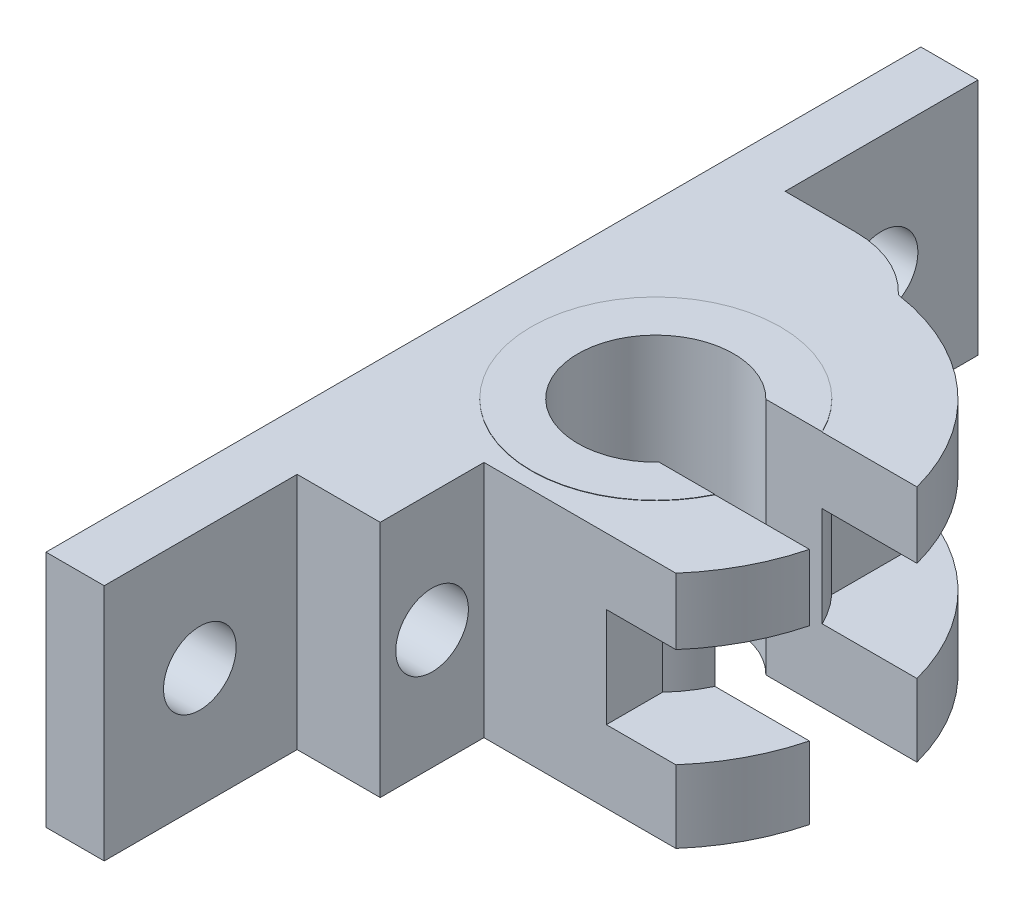
from build123d import *

# Parameters (mm, degrees)
SKETCH_1_R           = 20.68
SKETCH_1_R_2         = 9.68
EXTRUDE_1_DEPTH      = 116.68
SKETCH_11_W          = 27
SKETCH_11_H          = 150
CUT_EXTRUDE_3_DEPTH  = 40
SKETCH_13_W          = 10
SKETCH_13_H          = 128.345013401
CUT_EXTRUDE_7_DEPTH  = 126.614916312
SKETCH_15_W          = 8
SKETCH_15_H          = 68.68
CUT_EXTRUDE_9_DEPTH  = 48
SKETCH_16_W          = 15.549431524
SKETCH_16_H          = 20
SKETCH_16_W_2        = 15.459431524
EXTRUDE_4_DEPTH      = 19.2
SKETCH_17_W          = 19.20851187
SKETCH_17_H          = 14.03
CUT_EXTRUDE_10_DEPTH = 20.2
SKETCH_18_R          = 9.59
CUT_EXTRUDE_11_DEPTH = 121.289430957
SKETCH_21_R          = 2.985
CUT_EXTRUDE_12_DEPTH = 55.2
EXTRUDE_START        = 55.2
SKETCH_24_R          = 20.59
SKETCH_24_R_2        = 9.59
EXTRUDE_2_DEPTH      = 55.2
CUT_EXTRUDE_13_DEPTH = 55.2
SKETCH_26_W          = 10.00851187
SKETCH_26_H          = 41.68
CUT_EXTRUDE_15_DEPTH = 55.2
SKETCH_27_W          = 10
SKETCH_27_H          = 40
CUT_EXTRUDE_16_DEPTH = 55.2
SKETCH_28_W          = 44.880694938
SKETCH_28_H          = 9.608044066
CUT_EXTRUDE_17_DEPTH = 12.2
SKETCH_35_W          = 13.53
SKETCH_35_H          = 20
EXTRUDE_10_DEPTH     = 15
EXTRUDE_11_DEPTH     = 15
SKETCH_37_W          = 9
SKETCH_37_H          = 20
EXTRUDE_12_DEPTH     = 20
SKETCH_38_W          = 9
SKETCH_38_H          = 20
EXTRUDE_13_DEPTH     = 20
SKETCH_42_R          = 2.985
CUT_EXTRUDE_21_DEPTH = 20
CUT_EXTRUDE_23_DEPTH = 138.235841092
SKETCH_45_W          = 3
SKETCH_45_H          = 20
EXTRUDE_14_DEPTH     = 30
SKETCH_46_W          = 3
SKETCH_46_H          = 20
EXTRUDE_15_DEPTH     = 30
SKETCH_47_W          = 33.078221107
SKETCH_47_H          = 20
EXTRUDE_16_DEPTH     = 50
SKETCH_48_W          = 30
SKETCH_48_H          = 20
EXTRUDE_17_DEPTH     = 50
SKETCH_50_W          = 50
SKETCH_50_H          = 20
EXTRUDE_18_DEPTH     = 1
SKETCH_51_W          = 50
SKETCH_51_H          = 20
EXTRUDE_19_DEPTH     = 1
SKETCH_52_W          = 53
SKETCH_52_H          = 14
CUT_EXTRUDE_24_DEPTH = 151.972575738
SKETCH_53_W          = 53
SKETCH_53_H          = 14
CUT_EXTRUDE_25_DEPTH = 151.942387436
SKETCH_54_W          = 40
SKETCH_54_H          = 73.27
CUT_EXTRUDE_26_DEPTH = 147.866192927
SKETCH_56_W          = 13.00851187
SKETCH_56_H          = 20
EXTRUDE_21_DEPTH     = 3.08
SKETCH_60_W          = 6.504255935
SKETCH_60_H          = 76.35
CUT_EXTRUDE_30_DEPTH = 137.106994034
CUT_EXTRUDE_32_DEPTH = 20
SKETCH_64_W          = 16.20851187
SKETCH_64_H          = 0.09
EXTRUDE_22_DEPTH     = 20
SKETCH_65_W          = 3.495744065
SKETCH_65_H          = 3.26
CUT_EXTRUDE_33_DEPTH = 137.057988464
SKETCH_66_W          = 3.495744065
SKETCH_66_H          = 1.776778893
SKETCH_66_W_2        = 3.503635083
SKETCH_66_H_2        = 1.775
EXTRUDE_23_DEPTH     = 20.2
SKETCH_68_W          = 6.504255935
SKETCH_68_H          = 3.66
CUT_EXTRUDE_34_DEPTH = 20
SKETCH_69_R          = 2.985
CUT_EXTRUDE_35_DEPTH = 126.598983893
SKETCH_70_R          = 2.985
CUT_EXTRUDE_36_DEPTH = 132.360728238
SKETCH_71_W          = 38.005321573
SKETCH_71_H          = 111.965885132
CUT_EXTRUDE_37_DEPTH = 147.475577566
SKETCH_72_R          = 9.7
CUT_EXTRUDE_38_DEPTH = 38.185254838
CUT_EXTRUDE_START    = -22
SKETCH_77_R          = 30.59
SKETCH_77_R_2        = 20.59
CUT_EXTRUDE_2_DEPTH  = 22
SKETCH_78_W          = 34.816185151
SKETCH_78_H          = 22.96559116
EXTRUDE_26_DEPTH     = 0.1
SKETCH_80_W          = 2.900031179
SKETCH_80_H          = 6.148706656
EXTRUDE_28_DEPTH     = 23.1
SKETCH_81_W          = 6.148706656
SKETCH_81_H          = 23.1
EXTRUDE_29_DEPTH     = 14.1
SKETCH_82_W          = 6.148706656
SKETCH_82_H          = 0.13440884
CUT_EXTRUDE_39_DEPTH = 19.1
SKETCH_83_W          = 2.900031179
SKETCH_83_H          = 22.96559116
EXTRUDE_30_DEPTH     = 19.1
FILLET_1_R           = 10
SKETCH_84_W          = 3.5
SKETCH_84_H          = 19.1
EXTRUDE_31_DEPTH     = 23.1
SKETCH_85_W          = 3.5
SKETCH_85_H          = 0.52
CUT_EXTRUDE_40_DEPTH = 48.860163141
SKETCH_86_W          = 3.5
SKETCH_86_H          = 22.96559116
EXTRUDE_32_DEPTH     = 62.1
SKETCH_87_W          = 3.60851187
SKETCH_87_H          = 34.816185151
CUT_EXTRUDE_41_DEPTH = 62.1
SKETCH_89_W          = 0.10851187
SKETCH_89_H          = 6.15
EXTRUDE_33_DEPTH     = 23.1
EXTRUDE_34_DEPTH     = 22.1
SKETCH_91_W          = 0.971561636
SKETCH_91_H          = 22.96559116
CUT_EXTRUDE_42_DEPTH = 22.1
SKETCH_95_W          = 6.15
SKETCH_95_H          = 22.96559116
EXTRUDE_35_DEPTH     = 14.1
FILLET_2_R           = 10
SKETCH_96_W          = 3.60851187
SKETCH_96_H          = 2.548438364
CUT_EXTRUDE_43_DEPTH = 55.35700885
SKETCH_97_W          = 3.5
SKETCH_97_H          = 6.148706656
EXTRUDE_36_DEPTH     = 23.1
CUT_EXTRUDE_44_DEPTH = 23.1
SKETCH_99_W          = 6.15
SKETCH_99_H          = 0.13440884
CUT_EXTRUDE_45_DEPTH = 23.1
SKETCH_101_R         = 2.985
CUT_EXTRUDE_46_DEPTH = 23.1
SKETCH_103_W         = 3.60851187
SKETCH_103_H         = 0.54
CUT_EXTRUDE_49_DEPTH = 53.222714265
SKETCH_104_W         = 3.60851187
SKETCH_104_H         = 0.54
CUT_EXTRUDE_50_DEPTH = 53.222714265
SKETCH_123_W         = 24.188706656
SKETCH_123_H         = 22.96559116
SKETCH_123_W_2       = 24.195376485
EXTRUDE_37_DEPTH     = 2
SKETCH_124_R         = 3.05
CUT_EXTRUDE_60_DEPTH = 57.152183688
SKETCH_126_W         = 29.889481087
SKETCH_126_H         = 8.39
CUT_EXTRUDE_61_DEPTH = 53.222714265
SKETCH_127_W         = 18.58
SKETCH_127_H         = 22.96559116
EXTRUDE_38_DEPTH     = 10
SKETCH_128_R         = 3.25
CUT_EXTRUDE_62_DEPTH = 58.155273368
SKETCH_129_R         = 3.25
CUT_EXTRUDE_63_DEPTH = 58.155273368
SKETCH_130_W         = 24.958479246
SKETCH_130_H         = 10
CUT_EXTRUDE_64_DEPTH = 53.058343712
SKETCH_136_W         = 10
SKETCH_136_H         = 18.585376485
CUT_EXTRUDE_68_DEPTH = 24
SKETCH_138_W         = 5.60851187
SKETCH_138_H         = 22.96559116
EXTRUDE_40_DEPTH     = 38
SKETCH_141_W         = 9.994623515
SKETCH_141_H         = 22.96559116
EXTRUDE_41_DEPTH     = 3.24
SKETCH_144_W         = 2
SKETCH_144_H         = 9.994623515
CUT_EXTRUDE_70_DEPTH = 32.24
SKETCH_146_R         = 3.5
CUT_EXTRUDE_72_DEPTH = 54.719053459
SKETCH_150_R         = 3.5
CUT_EXTRUDE_74_DEPTH = 50.508459618
SKETCH_152_W         = 22.731002657
SKETCH_152_H         = 10.39
CUT_EXTRUDE_75_DEPTH = 40.05
SKETCH_153_R         = 11.995
SKETCH_153_R_2       = 6.995
EXTRUDE_3_DEPTH      = 23
CUT_EXTRUDE_76_DEPTH = 27
SKETCH_156_R         = 7.5
CUT_EXTRUDE_77_DEPTH = 40


with BuildPart() as part:
    # 草圖1 → 伸長-薄件1 (new body)
    with BuildSketch(Plane(origin=(0, 0, 0), x_dir=(1, 0, 0), z_dir=(0, 1, 0))):
        Circle(SKETCH_1_R)
        Circle(SKETCH_1_R_2, mode=Mode.SUBTRACT)
    extrude(amount=EXTRUDE_1_DEPTH)

    # 草圖11 → 除料-伸長3 (cut)
    with BuildSketch(Plane(origin=(0, 116.68, 0), x_dir=(1, 0, 0), z_dir=(0, 1, 0))):
        with Locations((21.70851187, -44.235815192)):
            Rectangle(SKETCH_11_W, SKETCH_11_H)
    extrude(amount=-CUT_EXTRUDE_3_DEPTH, mode=Mode.SUBTRACT)

    # 草圖13 → 除料-伸長7 (cut, through all)
    with BuildSketch(Plane.XY.offset(21)):
        with Locations((-16, 58.612182466)):
            Rectangle(SKETCH_13_W, SKETCH_13_H)
    extrude(amount=-CUT_EXTRUDE_7_DEPTH, mode=Mode.SUBTRACT)

    # 草圖15 → 除料-伸長9 (cut)
    with BuildSketch(Plane.XY.offset(21)):
        with Locations((-1.395744065, 52.34)):
            Rectangle(SKETCH_15_W, SKETCH_15_H)
    extrude(amount=-CUT_EXTRUDE_9_DEPTH, mode=Mode.SUBTRACT)

    # 草圖16 → 填料-伸長4 (add)
    with BuildSketch(Plane(origin=(8.20851187, 0, 0), x_dir=(0, 0, -1), z_dir=(1, 0, 0))):
        with Locations((12.905284238, 106.68)):
            Rectangle(SKETCH_16_W, SKETCH_16_H)
        with Locations((-12.860284238, 106.68)):
            Rectangle(SKETCH_16_W_2, SKETCH_16_H)
    extrude(amount=-EXTRUDE_4_DEPTH)

    # 草圖17 → 除料-伸長10 (cut)
    with BuildSketch(Plane(origin=(0, 116.68, 0), x_dir=(1, 0, 0), z_dir=(0, 1, 0))):
        with Locations((-1.395744065, -0.045)):
            Rectangle(SKETCH_17_W, SKETCH_17_H)
    extrude(amount=-CUT_EXTRUDE_10_DEPTH, mode=Mode.SUBTRACT)

    # 草圖18 → 除料-伸長11 (cut, through all)
    with BuildSketch(Plane.XZ):
        with Locations(Location((0, 0, 0), (0, 0, 90))):
            Circle(SKETCH_18_R)
    extrude(amount=-CUT_EXTRUDE_11_DEPTH, mode=Mode.SUBTRACT)

    # 草圖21 → 除料-伸長12 (cut)
    with BuildSketch(Plane(origin=(0, 0, -20.68), x_dir=(-1, 0, 0), z_dir=(0, 0, -1))):
        with Locations((1.39148813, 108.73)):
            Circle(SKETCH_21_R)
    extrude(amount=-CUT_EXTRUDE_12_DEPTH, mode=Mode.SUBTRACT)

    # 草圖24 → 伸長-薄件2 (add)
    with BuildSketch(Plane.XZ.offset(EXTRUDE_START)):
        Circle(SKETCH_24_R)
        Circle(SKETCH_24_R_2, mode=Mode.SUBTRACT)
    extrude(amount=-EXTRUDE_2_DEPTH)

    # 草圖25 → 除料-伸長13 (cut)
    with BuildSketch(Plane.XY.offset(21)):
        Polygon((-1.39148813, -11.785), (22.612379708, -11.785), (22.612379708, -63.873337429), (-22.749525245, -63.873337429), (-22.749525245, -11.785), align=None)
    extrude(amount=-CUT_EXTRUDE_13_DEPTH, mode=Mode.SUBTRACT)

    # 草圖26 → 除料-伸長15 (cut)
    with BuildSketch(Plane(origin=(0, 0, 0), x_dir=(1, 0, 0), z_dir=(0, 1, 0))):
        with Locations((-15.995744065, -0.16)):
            Rectangle(SKETCH_26_W, SKETCH_26_H)
    extrude(amount=-CUT_EXTRUDE_15_DEPTH, mode=Mode.SUBTRACT)

    # 草圖27 → 除料-伸長16 (cut)
    with BuildSketch(Plane(origin=(21, 0, 0), x_dir=(0, 0, -1), z_dir=(1, 0, 0))):
        with Locations((0, 41.68)):
            Rectangle(SKETCH_27_W, SKETCH_27_H)
    extrude(amount=-CUT_EXTRUDE_16_DEPTH, mode=Mode.SUBTRACT)

    # 草圖28 → 除料-伸長17 (cut)
    with BuildSketch(Plane(origin=(21, 0, 0), x_dir=(0, 0, -1), z_dir=(1, 0, 0))):
        Rectangle(SKETCH_28_W, SKETCH_28_H)
    extrude(amount=-CUT_EXTRUDE_17_DEPTH, mode=Mode.SUBTRACT)

    # 草圖35 → 填料-伸長10 (add)
    with BuildSketch(Plane.ZY.offset(10.99148813)):
        with Locations((13.825, 106.68)):
            Rectangle(SKETCH_35_W, SKETCH_35_H)
    extrude(amount=EXTRUDE_10_DEPTH)

    # 草圖36 → 填料-伸長11 (add)
    with BuildSketch(Plane.ZY.offset(10.99148813)):
        Polygon((-20.68, 116.68), (-6.97, 116.68), (-6.97, 96.48), (-20.68, 96.68), align=None)
    extrude(amount=EXTRUDE_11_DEPTH)

    # 草圖37 → 填料-伸長12 (add)
    with BuildSketch(Plane.XY.offset(20.59)):
        with Locations((-21.49148813, 106.68)):
            Rectangle(SKETCH_37_W, SKETCH_37_H)
    extrude(amount=EXTRUDE_12_DEPTH)

    # 草圖38 → 填料-伸長13 (add)
    with BuildSketch(Plane(origin=(0, 0, -20.68), x_dir=(-1, 0, 0), z_dir=(0, 0, -1))):
        with Locations((21.49148813, 106.68)):
            Rectangle(SKETCH_38_W, SKETCH_38_H)
    extrude(amount=EXTRUDE_13_DEPTH)

    # 草圖42 → 除料-伸長21 (cut)
    with BuildSketch(Plane(origin=(-16.99148813, 0, 0), x_dir=(0, 0, -1), z_dir=(1, 0, 0))):
        with Locations((30.68, 106.554418142)):
            Circle(SKETCH_42_R)
        with Locations((-30.395640125, 106.68)):
            Circle(SKETCH_42_R)
    extrude(amount=-CUT_EXTRUDE_21_DEPTH, mode=Mode.SUBTRACT)

    # 草圖43 → 除料-伸長23 (cut, through all)
    with BuildSketch(Plane(origin=(0, 116.68, 0), x_dir=(1, 0, 0), z_dir=(0, 1, 0))):
        Polygon((-11, 6.97), (-10.99148813, 20.68), (-10.99148813, 48.096794253), (-28.274756234, 48.096794253), (-28.274756234, -43.270506289), (-11, -43.270506289), align=None)
    extrude(amount=-CUT_EXTRUDE_23_DEPTH, mode=Mode.SUBTRACT)

    # 草圖45 → 填料-伸長14 (add)
    with BuildSketch(Plane.XY.offset(20.59)):
        with Locations((-9.5, 106.68)):
            Rectangle(SKETCH_45_W, SKETCH_45_H)
    extrude(amount=EXTRUDE_14_DEPTH)

    # 草圖46 → 填料-伸長15 (add)
    with BuildSketch(Plane(origin=(0, 0, -20.68), x_dir=(-1, 0, 0), z_dir=(0, 0, -1))):
        with Locations((9.49148813, 106.68)):
            Rectangle(SKETCH_46_W, SKETCH_46_H)
    extrude(amount=EXTRUDE_15_DEPTH)

    # 草圖47 → 填料-伸長16 (add)
    with BuildSketch(Plane.ZY.offset(11)):
        with Locations((34.050889447, 106.68)):
            Rectangle(SKETCH_47_W, SKETCH_47_H)
    extrude(amount=EXTRUDE_16_DEPTH)

    # 草圖48 → 填料-伸長17 (add)
    with BuildSketch(Plane.ZY.offset(10.99148813)):
        with Locations((-35.68, 106.68)):
            Rectangle(SKETCH_48_W, SKETCH_48_H)
    extrude(amount=EXTRUDE_17_DEPTH)

    # 草圖50 → 填料-伸長18 (add)
    with BuildSketch(Plane(origin=(0, 0, 17.511778893), x_dir=(-1, 0, 0), z_dir=(0, 0, -1))):
        with Locations((36, 106.68)):
            Rectangle(SKETCH_50_W, SKETCH_50_H)
    extrude(amount=EXTRUDE_18_DEPTH)

    # 草圖51 → 填料-伸長19 (add)
    with BuildSketch(Plane.XY.offset(-20.68)):
        with Locations((-35.99148813, 106.68)):
            Rectangle(SKETCH_51_W, SKETCH_51_H)
    extrude(amount=EXTRUDE_19_DEPTH)

    # 草圖52 → 除料-伸長24 (cut, through all)
    with BuildSketch(Plane(origin=(0, 116.68, 0), x_dir=(1, 0, 0), z_dir=(0, 1, 0))):
        with Locations((-34.49148813, 43.68)):
            Rectangle(SKETCH_52_W, SKETCH_52_H)
    extrude(amount=-CUT_EXTRUDE_24_DEPTH, mode=Mode.SUBTRACT)

    # 草圖53 → 除料-伸長25 (cut, through all)
    with BuildSketch(Plane(origin=(0, 116.68, 0), x_dir=(1, 0, 0), z_dir=(0, 1, 0))):
        with Locations((-34.5, -43.59)):
            Rectangle(SKETCH_53_W, SKETCH_53_H)
    extrude(amount=-CUT_EXTRUDE_25_DEPTH, mode=Mode.SUBTRACT)

    # 草圖54 → 除料-伸長26 (cut, through all)
    with BuildSketch(Plane(origin=(0, 116.68, 0), x_dir=(1, 0, 0), z_dir=(0, 1, 0))):
        with Locations((-41, 0.045)):
            Rectangle(SKETCH_54_W, SKETCH_54_H)
    extrude(amount=-CUT_EXTRUDE_26_DEPTH, mode=Mode.SUBTRACT)

    # 草圖56 → 填料-伸長21 (add)
    with BuildSketch(Plane(origin=(0, 0, -36.68), x_dir=(-1, 0, 0), z_dir=(0, 0, -1))):
        with Locations((14.495744065, 106.68)):
            Rectangle(SKETCH_56_W, SKETCH_56_H)
    extrude(amount=EXTRUDE_21_DEPTH)

    # 草圖60 → 除料-伸長30 (cut, through all)
    with BuildSketch(Plane(origin=(0, 116.68, 0), x_dir=(1, 0, 0), z_dir=(0, 1, 0))):
        with Locations((-17.747872032, 1.585)):
            Rectangle(SKETCH_60_W, SKETCH_60_H)
    extrude(amount=-CUT_EXTRUDE_30_DEPTH, mode=Mode.SUBTRACT)

    # 草圖61 → 除料-伸長32 (cut)
    with BuildSketch(Plane(origin=(0, 116.68, 0), x_dir=(1, 0, 0), z_dir=(0, 1, 0))):
        Polygon((1.92725193, -20.59), (1.92725193, -22.399121663), (-2.174190472, -21.421542421), (-2.174190472, -20.59), align=None)
    extrude(amount=-CUT_EXTRUDE_32_DEPTH, mode=Mode.SUBTRACT)

    # 草圖64 → 填料-伸長22 (add)
    with BuildSketch(Plane(origin=(0, 116.68, 0), x_dir=(1, 0, 0), z_dir=(0, 1, 0))):
        with Locations((0.104255935, -20.635)):
            Rectangle(SKETCH_64_W, SKETCH_64_H)
    extrude(amount=-EXTRUDE_22_DEPTH)

    # 草圖65 → 除料-伸長33 (cut, through all)
    with BuildSketch(Plane(origin=(0, 116.68, 0), x_dir=(1, 0, 0), z_dir=(0, 1, 0))):
        with Locations((-12.747872033, -18.141778893)):
            Rectangle(SKETCH_65_W, SKETCH_65_H)
    extrude(amount=-CUT_EXTRUDE_33_DEPTH, mode=Mode.SUBTRACT)

    # 草圖66 → 填料-伸長23 (add)
    with BuildSketch(Plane(origin=(0, 96.48, 0), x_dir=(1, 0, 0), z_dir=(0, 1, 0))):
        with Locations((-12.747872033, -18.883389447)):
            Rectangle(SKETCH_66_W, SKETCH_66_H)
        with Locations((-12.743926524, 18.7925)):
            Rectangle(SKETCH_66_W_2, SKETCH_66_H_2)
    extrude(amount=EXTRUDE_23_DEPTH)

    # 草圖68 → 除料-伸長34 (cut)
    with BuildSketch(Plane(origin=(0, 116.68, 0), x_dir=(1, 0, 0), z_dir=(0, 1, 0))):
        with Locations((-11.243616098, 37.93)):
            Rectangle(SKETCH_68_W, SKETCH_68_H)
    extrude(amount=-CUT_EXTRUDE_34_DEPTH, mode=Mode.SUBTRACT)

    # 草圖69 → 除料-伸長35 (cut, through all)
    with BuildSketch(Plane(origin=(-7.99148813, 0, 0), x_dir=(0, 0, -1), z_dir=(1, 0, 0))):
        with Locations((28.39, 106.68)):
            Circle(SKETCH_69_R)
        with Locations((-28.635, 106.68)):
            Circle(SKETCH_69_R)
    extrude(amount=-CUT_EXTRUDE_35_DEPTH, mode=Mode.SUBTRACT)

    # 草圖70 → 除料-伸長36 (cut, through all)
    with BuildSketch(Plane(origin=(0, 0, 20.59), x_dir=(-1, 0, 0), z_dir=(0, 0, -1))):
        with Locations((1.39148813, 108.73)):
            Circle(SKETCH_70_R)
    extrude(amount=-CUT_EXTRUDE_36_DEPTH, mode=Mode.SUBTRACT)

    # 草圖71 → 除料-伸長37 (cut, through all)
    with BuildSketch(Plane.XY.offset(50)):
        with Locations((2.76131712, 67.163533726)):
            Rectangle(SKETCH_71_W, SKETCH_71_H)
    extrude(amount=-CUT_EXTRUDE_37_DEPTH, mode=Mode.SUBTRACT)

    # 草圖72 → 除料-伸長38 (cut, through all)
    with BuildSketch(Plane.XZ.offset(11.785)):
        with Locations(Location((0, 0, 0), (0, 0, 270))):
            Circle(SKETCH_72_R)
    extrude(amount=-CUT_EXTRUDE_38_DEPTH, mode=Mode.SUBTRACT)

    # 草圖77 → 除料-伸長-薄件2 (cut)
    with BuildSketch(Plane(origin=(0, 11.18059116, 0), x_dir=(1, 0, 0), z_dir=(0, 1, 0)).offset(CUT_EXTRUDE_START)):
        Circle(SKETCH_77_R)
        Circle(SKETCH_77_R_2, mode=Mode.SUBTRACT)
    extrude(amount=CUT_EXTRUDE_2_DEPTH, mode=Mode.SUBTRACT)

    # 草圖78 → 填料-伸長26 (add)
    with BuildSketch(Plane.ZY.offset(11)):
        with Locations((-0.002688243, -0.30220442)):
            Rectangle(SKETCH_78_W, SKETCH_78_H)
    extrude(amount=EXTRUDE_26_DEPTH)



with BuildPart() as body_2:
    # 草圖80 → 填料-伸長28 (new body)
    with BuildSketch(Plane.XZ.offset(11.785)):
        with Locations((-12.55001559, -20.485134146)):
            Rectangle(SKETCH_80_W, SKETCH_80_H)
    extrude(amount=-EXTRUDE_28_DEPTH)


with BuildPart() as part_1:
    add(part.part)

    add(body_2.part)  # 填料-伸長29 merges body 2
    # 草圖81 → 填料-伸長29 (add)
    with BuildSketch(Plane(origin=(-11.1, 0, 0), x_dir=(0, 0, -1), z_dir=(1, 0, 0))):
        with Locations((20.485134146, -0.235)):
            Rectangle(SKETCH_81_W, SKETCH_81_H)
    extrude(amount=EXTRUDE_29_DEPTH)

    # 草圖82 → 除料-伸長39 (cut)
    with BuildSketch(Plane(origin=(3, 0, 0), x_dir=(0, 0, -1), z_dir=(1, 0, 0))):
        with Locations((20.485134146, 11.24779558)):
            Rectangle(SKETCH_82_W, SKETCH_82_H)
    extrude(amount=-CUT_EXTRUDE_39_DEPTH, mode=Mode.SUBTRACT)

    # 草圖83 → 填料-伸長30 (add)
    with BuildSketch(Plane.XY.offset(-17.410780818)):
        with Locations((-12.55001559, -0.30220442)):
            Rectangle(SKETCH_83_W, SKETCH_83_H)
    extrude(amount=-EXTRUDE_30_DEPTH)

    # 圓角1
    # the kernel refuses this fillet: 10 mm, written as the material it takes off along each edge
    with BuildSketch(Plane(origin=(3, -30.090254449, -23.559487474), x_dir=(-1, 0, 0), z_dir=(0, 1, 0))) as fillet_1_piece_1:
        with BuildLine():
            CenterArc((7.32210178, 10), FILLET_1_R, 222.927997508, 47.072002492)
            Line((0, 3.189212562), (-0.146442036, 3.052996813))
            ThreePointArc((-0.146442036, 3.052996813), (-0.2, 1.594606281), (-0.2, 0))
            Line((-0.2, 0), (0, -0.2))
            Line((0, -0.2), (7.32210178, -0.2))
            Line((7.32210178, -0.2), (7.32210178, 0))
        make_face()
    extrude(amount=59.576100059, mode=Mode.SUBTRACT)

    # 草圖84 → 填料-伸長31 (add)
    with BuildSketch(Plane(origin=(0, -11.785, 0), x_dir=(-1, 0, 0), z_dir=(0, -1, 0))):
        with Locations((12.85, 26.960780818)):
            Rectangle(SKETCH_84_W, SKETCH_84_H)
    extrude(amount=-EXTRUDE_31_DEPTH)

    # 草圖85 → 除料-伸長40 (cut, through all)
    with BuildSketch(Plane.XZ.offset(11.785)):
        with Locations((-12.85, -36.250780818)):
            Rectangle(SKETCH_85_W, SKETCH_85_H)
    extrude(amount=-CUT_EXTRUDE_40_DEPTH, mode=Mode.SUBTRACT)

    # 草圖86 → 填料-伸長32 (add)
    with BuildSketch(Plane.XY.offset(-17.410780818)):
        with Locations((-12.85, -0.30220442)):
            Rectangle(SKETCH_86_W, SKETCH_86_H)
    extrude(amount=EXTRUDE_32_DEPTH)

    # 草圖87 → 除料-伸長41 (cut)
    with BuildSketch(Plane.XZ.offset(11.785)):
        with Locations((-12.795744065, -0.002688243)):
            Rectangle(SKETCH_87_W, SKETCH_87_H)
    extrude(amount=-CUT_EXTRUDE_41_DEPTH, mode=Mode.SUBTRACT)


with BuildPart() as cut_extrude_41_piece_1:
    # of the separate pieces the step leaves, piece 1, a body of its own (cut_extrude_41_pieces)
    add(part_1.part.solids().sort_by_distance((3, 11.18059116, -20.370274912))[0])



with BuildPart() as cut_extrude_41_piece_2:
    # of the separate pieces the step leaves, piece 2, a body of its own (cut_extrude_41_pieces)
    add(part_1.part.solids().sort_by_distance((-11.1, 11.18059116, 17.405404333))[0])

    # 草圖89 → 填料-伸長33 (add)
    with BuildSketch(Plane.XZ.offset(11.785)):
        with Locations((-11.045744065, 20.485780818)):
            Rectangle(SKETCH_89_W, SKETCH_89_H)
    extrude(amount=-EXTRUDE_33_DEPTH)

    # 草圖90 → 填料-伸長34 (add)
    with BuildSketch(Plane.XY.offset(23.560780818)):
        Polygon((-11, 11.18059116), (-11.1, 11.18059116), (-11.1, -11.785), (-10.99148813, -11.785), (-10.99148813, 11.18059116), align=None)
    extrude(amount=EXTRUDE_34_DEPTH)

    # 草圖91 → 除料-伸長42 (cut)
    with BuildSketch(Plane.ZY.offset(11.1)):
        with Locations((45.175, -0.30220442)):
            Rectangle(SKETCH_91_W, SKETCH_91_H)
    extrude(amount=-CUT_EXTRUDE_42_DEPTH, mode=Mode.SUBTRACT)


with BuildPart() as cut_extrude_41_piece_1_1:
    add(cut_extrude_41_piece_1.part)

    add(cut_extrude_41_piece_2.part)  # 填料-伸長35 merges 除料-伸長41 piece 2
    # 草圖95 → 填料-伸長35 (add)
    with BuildSketch(Plane(origin=(-10.99148813, 0, 0), x_dir=(0, 0, -1), z_dir=(1, 0, 0))):
        with Locations((-20.485780818, -0.30220442)):
            Rectangle(SKETCH_95_W, SKETCH_95_H)
    extrude(amount=EXTRUDE_35_DEPTH)

    # 圓角2
    # the kernel refuses this fillet: 10 mm, written as the material it takes off along each edge
    with BuildSketch(Plane(origin=(3.10851187, -30.131013506, 23.560780818), x_dir=(-1, 0, 0), z_dir=(0, 1, 0))) as fillet_2_piece_1:
        with BuildLine():
            CenterArc((7.338405402, -10), FILLET_2_R, 90, 47.209333859)
            Line((0, -3.206782342), (-0.146768108, -3.070917989))
            ThreePointArc((-0.146768108, -3.070917989), (-0.2, -1.603391171), (-0.2, 0))
            Line((-0.2, 0), (0, 0.2))
            Line((0, 0.2), (7.338405402, 0.2))
            Line((7.338405402, 0.2), (7.338405402, 0))
        make_face()
    extrude(amount=59.657618171, mode=Mode.SUBTRACT)

    # 草圖96 → 除料-伸長43 (cut, through all)
    with BuildSketch(Plane.XZ.offset(11.785)):
        with Locations((-12.795744065, 43.415)):
            Rectangle(SKETCH_96_W, SKETCH_96_H)
    extrude(amount=-CUT_EXTRUDE_43_DEPTH, mode=Mode.SUBTRACT)

    # 草圖97 → 填料-伸長36 (add)
    with BuildSketch(Plane.XZ.offset(11.785)):
        with Locations((-12.85, -39.065134146)):
            Rectangle(SKETCH_97_W, SKETCH_97_H)
    extrude(amount=-EXTRUDE_36_DEPTH)

    # 草圖98 → 除料-伸長44 (cut)
    with BuildSketch(Plane(origin=(-11.1, 0, 0), x_dir=(0, 0, -1), z_dir=(1, 0, 0))):
        Polygon((17.410780818, 11.18059116), (17.410780818, 11.315), (22.198280677, 11.315), (38.461669752, 11.315), (42.139487474, 11.315), (42.139487474, 11.18059116), align=None)
    extrude(amount=-CUT_EXTRUDE_44_DEPTH, mode=Mode.SUBTRACT)

    # 草圖99 → 除料-伸長45 (cut)
    with BuildSketch(Plane(origin=(-10.99148813, 0, 0), x_dir=(0, 0, -1), z_dir=(1, 0, 0))):
        with Locations((-20.485780818, 11.24779558)):
            Rectangle(SKETCH_99_W, SKETCH_99_H)
    extrude(amount=-CUT_EXTRUDE_45_DEPTH, mode=Mode.SUBTRACT)

    # 草圖101 → 除料-伸長46 (cut)
    with BuildSketch(Plane(origin=(-10.99148813, 0, 0), x_dir=(0, 0, -1), z_dir=(1, 0, 0))):
        with Locations((-32.928668636, -0.30220442)):
            Circle(SKETCH_101_R)
        with Locations((32.849487474, -0.30220442)):
            Circle(SKETCH_101_R)
    extrude(amount=-CUT_EXTRUDE_46_DEPTH, mode=Mode.SUBTRACT)

    # 草圖103 → 除料-伸長49 (cut, through all)
    with BuildSketch(Plane(origin=(0, 11.18059116, 0), x_dir=(1, 0, 0), z_dir=(0, 1, 0))):
        with Locations((-12.795744065, -17.675404333)):
            Rectangle(SKETCH_103_W, SKETCH_103_H)
    extrude(amount=-CUT_EXTRUDE_49_DEPTH, mode=Mode.SUBTRACT)

    # 草圖104 → 除料-伸長50 (cut, through all)
    with BuildSketch(Plane(origin=(0, 11.18059116, 0), x_dir=(1, 0, 0), z_dir=(0, 1, 0))):
        with Locations((-12.795744065, 17.680780818)):
            Rectangle(SKETCH_104_W, SKETCH_104_H)
    extrude(amount=-CUT_EXTRUDE_50_DEPTH, mode=Mode.SUBTRACT)

    # 草圖123 → 填料-伸長37 (add)
    with BuildSketch(Plane.ZY.offset(14.6)):
        with Locations((-30.045134146, -0.30220442)):
            Rectangle(SKETCH_123_W, SKETCH_123_H)
        with Locations((30.043092576, -0.30220442)):
            Rectangle(SKETCH_123_W_2, SKETCH_123_H)
    extrude(amount=EXTRUDE_37_DEPTH)

    # 草圖124 → 除料-伸長60 (cut, through all)
    with BuildSketch(Plane(origin=(-14.6, 0, 0), x_dir=(0, 0, -1), z_dir=(1, 0, 0))):
        with Locations((32.849487474, -0.30220442)):
            Circle(SKETCH_124_R)
        with Locations((-32.928668636, -0.30220442)):
            Circle(SKETCH_124_R)
    extrude(amount=-CUT_EXTRUDE_60_DEPTH, mode=Mode.SUBTRACT)

    # 草圖126 → 除料-伸長61 (cut, through all)
    with BuildSketch(Plane(origin=(0, 11.18059116, 0), x_dir=(1, 0, 0), z_dir=(0, 1, 0))):
        with Locations((20.589926908, 0.054862893)):
            Rectangle(SKETCH_126_W, SKETCH_126_H)
    extrude(amount=-CUT_EXTRUDE_61_DEPTH, mode=Mode.SUBTRACT)

    # 草圖127 → 填料-伸長38 (add)
    with BuildSketch(Plane(origin=(-10.99148813, 0, 0), x_dir=(0, 0, -1), z_dir=(1, 0, 0))):
        with Locations((-32.850780818, -0.30220442)):
            Rectangle(SKETCH_127_W, SKETCH_127_H)
    extrude(amount=EXTRUDE_38_DEPTH)

    # 草圖128 → 除料-伸長62 (cut, through all)
    with BuildSketch(Plane.ZY.offset(16.6)):
        with Locations((32.928668636, -0.30220442)):
            Circle(SKETCH_128_R)
    extrude(amount=-CUT_EXTRUDE_62_DEPTH, mode=Mode.SUBTRACT)

    # 草圖129 → 除料-伸長63 (cut, through all)
    with BuildSketch(Plane.ZY.offset(16.6)):
        with Locations((-32.849487474, -0.30220442)):
            Circle(SKETCH_129_R)
    extrude(amount=-CUT_EXTRUDE_63_DEPTH, mode=Mode.SUBTRACT)

    # 草圖130 → 除料-伸長64 (cut, through all)
    with BuildSketch(Plane(origin=(0, 11.18059116, 0), x_dir=(1, 0, 0), z_dir=(0, 1, 0))):
        with Locations((8.24934609, -18.560780818)):
            Rectangle(SKETCH_130_W, SKETCH_130_H)
    extrude(amount=-CUT_EXTRUDE_64_DEPTH, mode=Mode.SUBTRACT)

    # 草圖136 → 除料-伸長68 (cut)
    with BuildSketch(Plane(origin=(0, 11.18059116, 0), x_dir=(1, 0, 0), z_dir=(0, 1, 0))):
        with Locations((-5.99148813, -32.848092576)):
            Rectangle(SKETCH_136_W, SKETCH_136_H)
    extrude(amount=-CUT_EXTRUDE_68_DEPTH, mode=Mode.SUBTRACT)

    # 草圖138 → 填料-伸長40 (add)
    with BuildSketch(Plane.XY.offset(-17.950780818)):
        with Locations((-13.795744065, -0.30220442)):
            Rectangle(SKETCH_138_W, SKETCH_138_H)
    extrude(amount=EXTRUDE_40_DEPTH)

    # 草圖141 → 填料-伸長41 (add)
    with BuildSketch(Plane(origin=(-4.229893533, 0, 0), x_dir=(0, 0, -1), z_dir=(1, 0, 0))):
        with Locations((-18.558092576, -0.30220442)):
            Rectangle(SKETCH_141_W, SKETCH_141_H)
    extrude(amount=EXTRUDE_41_DEPTH)

    # 草圖144 → 除料-伸長70 (cut)
    with BuildSketch(Plane(origin=(0, 11.18059116, 0), x_dir=(1, 0, 0), z_dir=(0, 1, 0))):
        with Locations((-1.989893533, -18.558092576)):
            Rectangle(SKETCH_144_W, SKETCH_144_H)
    extrude(amount=-CUT_EXTRUDE_70_DEPTH, mode=Mode.SUBTRACT)

    # 草圖146 → 除料-伸長72 (cut, through all)
    with BuildSketch(Plane(origin=(-10.99148813, 0, 0), x_dir=(0, 0, -1), z_dir=(1, 0, 0))):
        with Locations((-32.928668636, -0.30220442)):
            Circle(SKETCH_146_R)
        with Locations((32.849487474, -0.30220442)):
            Circle(SKETCH_146_R)
    extrude(amount=-CUT_EXTRUDE_72_DEPTH, mode=Mode.SUBTRACT)

    # 草圖150 → 除料-伸長74 (cut, through all)
    with BuildSketch(Plane(origin=(-2.989893533, 0, 0), x_dir=(0, 0, -1), z_dir=(1, 0, 0))):
        with Locations((-18.558092575, -0.30220442)):
            Circle(SKETCH_150_R)
    extrude(amount=-CUT_EXTRUDE_74_DEPTH, mode=Mode.SUBTRACT)

    # 草圖152 → 除料-伸長75 (cut)
    with BuildSketch(Plane(origin=(0, 11.18059116, 0), x_dir=(1, 0, 0), z_dir=(0, 1, 0))):
        with Locations((17.050778936, 0.054862893)):
            Rectangle(SKETCH_152_W, SKETCH_152_H)
    extrude(amount=-CUT_EXTRUDE_75_DEPTH, mode=Mode.SUBTRACT)

    # 草圖153 → 伸長-薄件3 (add)
    with BuildSketch(Plane.XZ.offset(11.785)):
        Circle(SKETCH_153_R)
        Circle(SKETCH_153_R_2, mode=Mode.SUBTRACT)
    extrude(amount=-EXTRUDE_3_DEPTH)

    # 草圖155 → 除料-伸長76 (cut)
    with BuildSketch(Plane.XZ.offset(11.785)):
        Polygon((10.837851057, 5.140137107), (1.186892734, 5.140137107), (4.194530467, -5.249862893), (13.472328218, -5.249862893), (13.472328218, 5.140137107), align=None)
    extrude(amount=-CUT_EXTRUDE_76_DEPTH, mode=Mode.SUBTRACT)

    # 草圖156 → 除料-伸長77 (cut)
    with BuildSketch(Plane.XZ.offset(11.785)):
        Circle(SKETCH_156_R)
    extrude(amount=-CUT_EXTRUDE_77_DEPTH, mode=Mode.SUBTRACT)


solid = cut_extrude_41_piece_1_1.part
